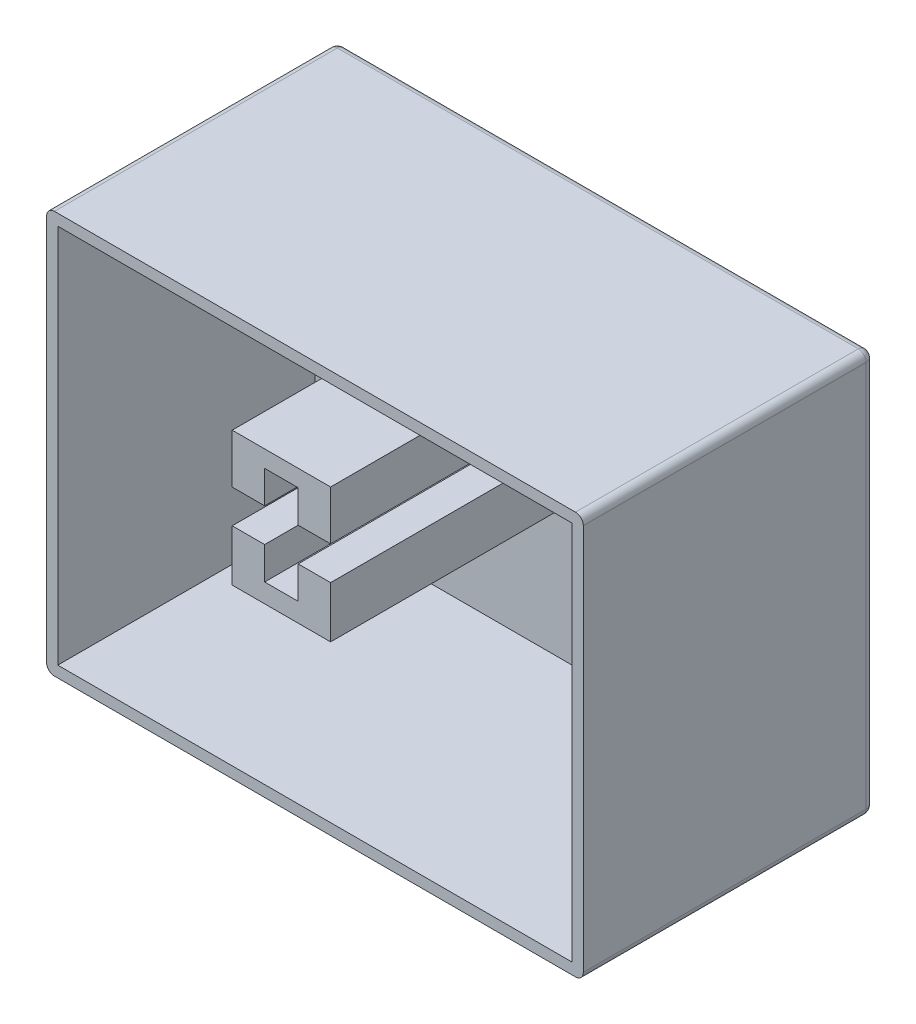
from build123d import *

# Parameters (mm, degrees)
SKETCH1_W           = 24
SKETCH1_H           = 18
BOSS_EXTRUDE1_DEPTH = 13
FILLET1_R           = 0.35
FILLET2_R           = 0.35
SKETCH2_W           = 23
SKETCH2_H           = 17
CUT_EXTRUDE1_DEPTH  = 11.5
SKETCH11_W          = 4.4
SKETCH11_H          = 6
BOSS_EXTRUDE4_DEPTH = 10
SKETCH12_W          = 4.4
SKETCH12_H          = 1.5
CUT_EXTRUDE6_DEPTH  = 10
SKETCH13_W          = 1.5
SKETCH13_H          = 4.4
CUT_EXTRUDE7_DEPTH  = 10


with BuildPart() as part:
    # Sketch1 → Boss-Extrude1 (new body)
    with BuildSketch(Plane.XY):
        Rectangle(SKETCH1_W, SKETCH1_H)
    extrude(amount=BOSS_EXTRUDE1_DEPTH)

    # Fillet1
    fillet1_edges = [part.edges().sort_by_distance(p)[0] for p in [
        (0, -9, 0),
        (-12, 0, 0),
        (0, 9, 0),
        (12, 0, 0),
    ]]
    fillet(fillet1_edges, radius=FILLET1_R)

    # Fillet2
    # the kernel refuses this fillet: 0.35 mm, written as the material it takes off along each edge
    with BuildSketch(Plane(origin=(11.65, 8.65, 0.35), x_dir=(0, 1, 0), z_dir=(1, 0, 0))) as fillet2_piece_1_section:
        Polygon((0, 0), (FILLET2_R, 0), (FILLET2_R, -FILLET2_R), (0, -FILLET2_R), align=None)
    fillet2_piece_1 = extrude(amount=FILLET2_R, mode=Mode.PRIVATE)
    fillet2_piece_1 = fillet2_piece_1 - Plane(origin=(11.65, 8.65, 0.35), x_dir=(0, -0.7071067811865475, 0.7071067811865475), z_dir=(1, 0, 0)) * Sphere(FILLET2_R, mode=Mode.PRIVATE)
    add(fillet2_piece_1, mode=Mode.SUBTRACT)
    with BuildSketch(Plane(origin=(11.65, -8.65, 0.35), x_dir=(1, 0, 0), z_dir=(0, -1, 0))) as fillet2_piece_2_section:
        Polygon((0, 0), (FILLET2_R, 0), (FILLET2_R, -FILLET2_R), (0, -FILLET2_R), align=None)
    fillet2_piece_2 = extrude(amount=FILLET2_R, mode=Mode.PRIVATE)
    fillet2_piece_2 = fillet2_piece_2 - Plane(origin=(11.65, -8.65, 0.35), x_dir=(-0.7071067811865475, 0, 0.7071067811865475), z_dir=(0, -1, 0)) * Sphere(FILLET2_R, mode=Mode.PRIVATE)
    add(fillet2_piece_2, mode=Mode.SUBTRACT)
    with BuildSketch(Plane(origin=(-11.65, 8.65, 0.35), x_dir=(0, 1, 0), z_dir=(-1, 0, 0))) as fillet2_piece_3_section:
        Polygon((0, 0), (FILLET2_R, 0), (FILLET2_R, FILLET2_R), (0, FILLET2_R), align=None)
    fillet2_piece_3 = extrude(amount=FILLET2_R, mode=Mode.PRIVATE)
    fillet2_piece_3 = fillet2_piece_3 - Plane(origin=(-11.65, 8.65, 0.35), x_dir=(0, -0.7071067811865475, 0.7071067811865475), z_dir=(-1, 0, 0)) * Sphere(FILLET2_R, mode=Mode.PRIVATE)
    add(fillet2_piece_3, mode=Mode.SUBTRACT)
    with BuildSketch(Plane(origin=(-11.65, -8.65, 0.35), x_dir=(-1, 0, 0), z_dir=(0, -1, 0))) as fillet2_piece_4_section:
        Polygon((0, 0), (FILLET2_R, 0), (FILLET2_R, FILLET2_R), (0, FILLET2_R), align=None)
    fillet2_piece_4 = extrude(amount=FILLET2_R, mode=Mode.PRIVATE)
    fillet2_piece_4 = fillet2_piece_4 - Plane(origin=(-11.65, -8.65, 0.35), x_dir=(0.7071067811865475, 0, 0.7071067811865475), z_dir=(0, -1, 0)) * Sphere(FILLET2_R, mode=Mode.PRIVATE)
    add(fillet2_piece_4, mode=Mode.SUBTRACT)
    with BuildSketch(Plane(origin=(12, -9, 0.35), x_dir=(-1, 0, 0), z_dir=(0, 0, 1)), Plane(origin=(12, 9, 0.35), x_dir=(0, -1, 0), z_dir=(0, 0, 1))) as fillet2_piece_5:
        with BuildLine():
            CenterArc((FILLET2_R, -FILLET2_R), FILLET2_R, 90, 90)
            Line((0, -FILLET2_R), (0, 0))
            Line((0, 0), (FILLET2_R, 0))
        make_face()
    extrude(amount=13.525, mode=Mode.SUBTRACT)
    with BuildSketch(Plane(origin=(-12, -9, 0.35), x_dir=(1, 0, 0), z_dir=(0, 0, 1)), Plane(origin=(-12, 9, 0.35), x_dir=(0, -1, 0), z_dir=(0, 0, 1))) as fillet2_piece_6:
        with BuildLine():
            CenterArc((FILLET2_R, FILLET2_R), FILLET2_R, 180, 90)
            Line((0, FILLET2_R), (0, 0))
            Line((0, 0), (FILLET2_R, 0))
        make_face()
    extrude(amount=13.525, mode=Mode.SUBTRACT)

    # Sketch2 → Cut-Extrude1 (cut)
    with BuildSketch(Plane.XY.offset(13)):
        Rectangle(SKETCH2_W, SKETCH2_H)
    extrude(amount=-CUT_EXTRUDE1_DEPTH, mode=Mode.SUBTRACT)

    # Sketch11 → Boss-Extrude4 (add)
    with BuildSketch(Plane.XY.offset(1.5)):
        with Locations((-3, 0)):
            Rectangle(SKETCH11_W, SKETCH11_H)
    extrude(amount=BOSS_EXTRUDE4_DEPTH)

    # Sketch12 → Cut-Extrude6 (cut)
    with BuildSketch(Plane.XY.offset(11.5)):
        with Locations((-3, 0.045549291)):
            Rectangle(SKETCH12_W, SKETCH12_H)
    extrude(amount=-CUT_EXTRUDE6_DEPTH, mode=Mode.SUBTRACT)

    # Sketch13 → Cut-Extrude7 (cut)
    with BuildSketch(Plane.XY.offset(11.5)):
        with Locations((-3, 0.045549291)):
            Rectangle(SKETCH13_W, SKETCH13_H)
    extrude(amount=-CUT_EXTRUDE7_DEPTH, mode=Mode.SUBTRACT)


solid = part.part
